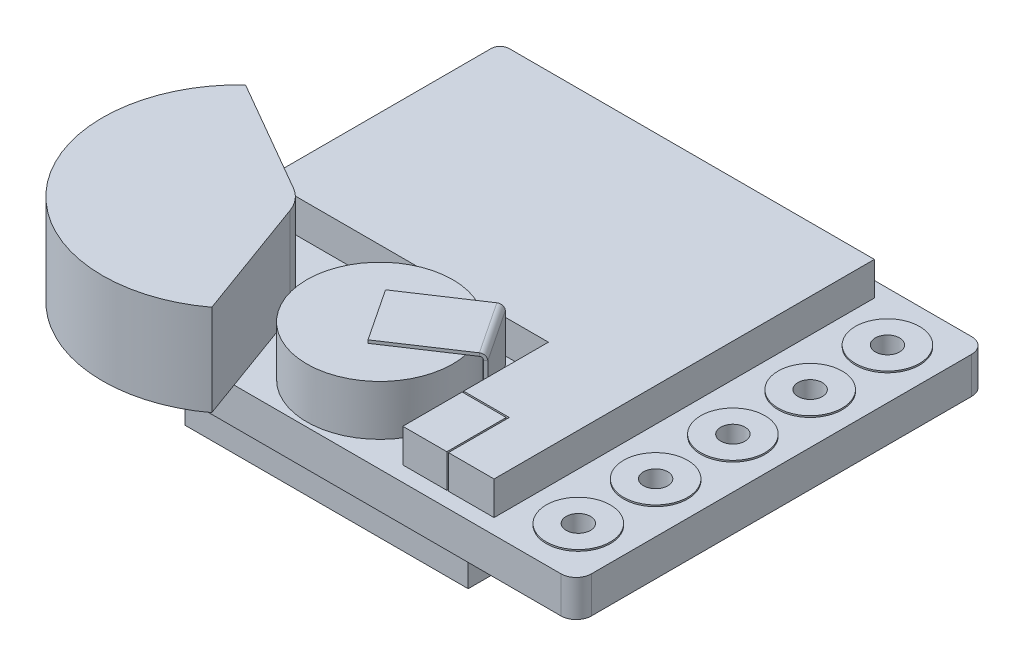
from build123d import *

# Parameters (mm, degrees)
ESQUISSE1_R                             = 0.4
PCB_DEPTH                               = 1.2
ESQUISSE2_R                             = 1.053612245
ESQUISSE2_R_2                           = 0.4
TOP_PADS_DEPTH                          = 0.05
BOTTOM_START                            = -1.25
ESQUISSE2_2_R                           = 1.053612245
ESQUISSE2_2_R_2                         = 0.4
BOTTOM_PADS_DEPTH                       = 0.05
ESQUISSE3_R                             = 2.4
BACKUP_BATT_DEPTH                       = 1.65
ANCILLARY_COMPS_DEPTH                   = 1.1
ESQUISSE5_W                             = 1.45
ESQUISSE5_H                             = 1.95
ACTIVITY_LED_DEPTH                      = 1.1
ESQUISSE6_W                             = 9.3
ESQUISSE6_H                             = 9.8
ATGM336H_MODULE_DEPTH                   = 2
MODULE_S_START                          = -0.25
ESQUISSE7_W                             = 1
ESQUISSE7_H                             = 1
MODULE_S_SOLDER_JOINTS_DEPTH            = 9.3
ESQUISSE8_R                             = 1.3
IPEX_CONNECTOR_SWIVEL_PLACEHOLDER_DEPTH = 3
BATTERY_TAB_BIS_DEPTH                   = 0.1
BATTERY_TAB_TER_STRIP_W                 = 0.6
BATTERY_TAB_TER_STRIP_H                 = 0.1
BATTERY_TAB_TER_STRIP_CUT_DEPTH         = 2.053720398
BATTERY_TAB_TER_DEPTH                   = 2.053720398


# Sheet-metal steps are written as plain solids
with BuildPart() as part:
    # Esquisse1 → PCB (new body)
    with BuildSketch(Plane(origin=(0, 0, 0), x_dir=(1, 0, 0), z_dir=(0, 1, 0))):
        with BuildLine():
            Line((-7.5, -6.75), (7.5, -6.75))
            ThreePointArc((7.5, -6.75), (7.853553391, -6.603553391), (8, -6.25))
            Line((8, -6.25), (8, 6.25))
            ThreePointArc((8, 6.25), (7.853553391, 6.603553391), (7.5, 6.75))
            Line((7.5, 6.75), (-7.5, 6.75))
            ThreePointArc((-7.5, 6.75), (-7.853553391, 6.603553391), (-8, 6.25))
            Line((-8, 6.25), (-8, -6.25))
            ThreePointArc((-8, -6.25), (-7.853553391, -6.603553391), (-7.5, -6.75))
        make_face()
        with Locations(Location((6.4, 0, 0), (0, 0, 270))):
            Circle(ESQUISSE1_R, mode=Mode.SUBTRACT)
        with Locations(Location((6.4, 2.54, 0), (0, 0, 270))):
            Circle(ESQUISSE1_R, mode=Mode.SUBTRACT)
        with Locations(Location((6.4, 5.08, 0), (0, 0, 270))):
            Circle(ESQUISSE1_R, mode=Mode.SUBTRACT)
        with Locations(Location((6.4, -5.08, 0), (0, 0, 90))):
            Circle(ESQUISSE1_R, mode=Mode.SUBTRACT)
        with Locations(Location((6.4, -2.54, 0), (0, 0, 90))):
            Circle(ESQUISSE1_R, mode=Mode.SUBTRACT)
    extrude(amount=PCB_DEPTH)

    # Esquisse2 → Top pads (add)
    # profile 1 of 5: a face of its own
    with BuildSketch(Plane(origin=(0, 1.2, 0), x_dir=(1, 0, 0), z_dir=(0, 1, 0))):
        with Locations(Location((6.4, 5.08, 0), (0, 0, 90))):
            Circle(ESQUISSE2_R)
        with Locations(Location((6.4, 5.08, 0), (0, 0, 270))):
            Circle(ESQUISSE2_R_2, mode=Mode.SUBTRACT)
    # profile 2 of 5: a face of its own
    with BuildSketch(Plane(origin=(0, 1.2, 0), x_dir=(1, 0, 0), z_dir=(0, 1, 0))):
        with Locations(Location((6.4, 2.54, 0), (0, 0, 90))):
            Circle(ESQUISSE2_R)
        with Locations(Location((6.4, 2.54, 0), (0, 0, 270))):
            Circle(ESQUISSE2_R_2, mode=Mode.SUBTRACT)
    # profile 3 of 5: a face of its own
    with BuildSketch(Plane(origin=(0, 1.2, 0), x_dir=(1, 0, 0), z_dir=(0, 1, 0))):
        with Locations(Location((6.4, 0, 0), (0, 0, 90))):
            Circle(ESQUISSE2_R)
        with Locations(Location((6.4, 0, 0), (0, 0, 270))):
            Circle(ESQUISSE2_R_2, mode=Mode.SUBTRACT)
    # profile 4 of 5: a face of its own
    with BuildSketch(Plane(origin=(0, 1.2, 0), x_dir=(1, 0, 0), z_dir=(0, 1, 0))):
        with Locations(Location((6.4, -2.54, 0), (0, 0, 90))):
            Circle(ESQUISSE2_R)
        with Locations(Location((6.4, -2.54, 0), (0, 0, 90))):
            Circle(ESQUISSE2_R_2, mode=Mode.SUBTRACT)
    # profile 5 of 5: a face of its own
    with BuildSketch(Plane(origin=(0, 1.2, 0), x_dir=(1, 0, 0), z_dir=(0, 1, 0))):
        with Locations(Location((6.4, -5.08, 0), (0, 0, 90))):
            Circle(ESQUISSE2_R)
        with Locations(Location((6.4, -5.08, 0), (0, 0, 90))):
            Circle(ESQUISSE2_R_2, mode=Mode.SUBTRACT)
    extrude(amount=TOP_PADS_DEPTH)

    # Esquisse2<2> → Bottom pads (add)
    # profile 1 of 5: a face of its own
    with BuildSketch(Plane(origin=(0, 1.2, 0), x_dir=(1, 0, 0), z_dir=(0, 1, 0)).offset(BOTTOM_START)):
        with Locations(Location((6.4, 5.08, 0), (0, 0, 90))):
            Circle(ESQUISSE2_2_R)
        with Locations(Location((6.4, 5.08, 0), (0, 0, 90))):
            Circle(ESQUISSE2_2_R_2, mode=Mode.SUBTRACT)
    # profile 2 of 5: a face of its own
    with BuildSketch(Plane(origin=(0, 1.2, 0), x_dir=(1, 0, 0), z_dir=(0, 1, 0)).offset(BOTTOM_START)):
        with Locations(Location((6.4, 2.54, 0), (0, 0, 90))):
            Circle(ESQUISSE2_2_R)
        with Locations(Location((6.4, 2.54, 0), (0, 0, 90))):
            Circle(ESQUISSE2_2_R_2, mode=Mode.SUBTRACT)
    # profile 3 of 5: a face of its own
    with BuildSketch(Plane(origin=(0, 1.2, 0), x_dir=(1, 0, 0), z_dir=(0, 1, 0)).offset(BOTTOM_START)):
        with Locations(Location((6.4, 0, 0), (0, 0, 90))):
            Circle(ESQUISSE2_2_R)
        with Locations(Location((6.4, 0, 0), (0, 0, 90))):
            Circle(ESQUISSE2_2_R_2, mode=Mode.SUBTRACT)
    # profile 4 of 5: a face of its own
    with BuildSketch(Plane(origin=(0, 1.2, 0), x_dir=(1, 0, 0), z_dir=(0, 1, 0)).offset(BOTTOM_START)):
        with Locations(Location((6.4, -2.54, 0), (0, 0, 90))):
            Circle(ESQUISSE2_2_R)
        with Locations(Location((6.4, -2.54, 0), (0, 0, 90))):
            Circle(ESQUISSE2_2_R_2, mode=Mode.SUBTRACT)
    # profile 5 of 5: a face of its own
    with BuildSketch(Plane(origin=(0, 1.2, 0), x_dir=(1, 0, 0), z_dir=(0, 1, 0)).offset(BOTTOM_START)):
        with Locations(Location((6.4, -5.08, 0), (0, 0, 90))):
            Circle(ESQUISSE2_2_R)
        with Locations(Location((6.4, -5.08, 0), (0, 0, 90))):
            Circle(ESQUISSE2_2_R_2, mode=Mode.SUBTRACT)
    extrude(amount=BOTTOM_PADS_DEPTH)

    # Esquisse3 → Backup batt (add)
    with BuildSketch(Plane(origin=(0, 1.2, 0), x_dir=(1, 0, 0), z_dir=(0, 1, 0))):
        with Locations(Location((-1, -4.204961255, 0), (0, 0, 90))):
            Circle(ESQUISSE3_R)
    extrude(amount=BACKUP_BATT_DEPTH)

    # Esquisse4 → ancillary comps (add)
    with BuildSketch(Plane(origin=(0, 1.2, 0), x_dir=(1, 0, 0), z_dir=(0, 1, 0))):
        with BuildLine():
            Line((-7.2, -1.462995273), (1.8, -1.462995273))
            Line((1.8, -1.462995273), (1.8, -4.25))
            Line((1.8, -4.25), (3.3, -4.25))
            Line((3.3, -4.25), (3.3, -6.25))
            Line((3.3, -6.25), (4.8, -6.25))
            Line((4.8, -6.25), (4.8, 6.25))
            Line((4.8, 6.25), (-7.2, 6.25))
            ThreePointArc((-7.2, 6.25), (-7.412132034, 6.162132034), (-7.5, 5.95))
            Line((-7.5, 5.95), (-7.5, -1.162995273))
            ThreePointArc((-7.5, -1.162995273), (-7.412132034, -1.375127307), (-7.2, -1.462995273))
        make_face()
    extrude(amount=ANCILLARY_COMPS_DEPTH)

    # Esquisse6 → ATGM336H module (add)
    with BuildSketch(Plane.XZ):
        with Locations((-1.45, 0.6)):
            Rectangle(ESQUISSE6_W, ESQUISSE6_H)
    extrude(amount=ATGM336H_MODULE_DEPTH)

    # Esquisse7 → module's solder joints (add)
    with BuildSketch(Plane(origin=(0, 0, -4.3), x_dir=(-1, 0, 0), z_dir=(0, 0, -1)).offset(MODULE_S_START)):
        with Locations((6.6, -0.5)):
            Rectangle(ESQUISSE7_W, ESQUISSE7_H)
        with Locations((-3.7, -0.5)):
            Rectangle(ESQUISSE7_W, ESQUISSE7_H)
    extrude(amount=-MODULE_S_SOLDER_JOINTS_DEPTH)


with BuildPart() as body_2:
    # Esquisse5 → Activity led (new body)
    with BuildSketch(Plane(origin=(0, 1.2, 0), x_dir=(1, 0, 0), z_dir=(0, 1, 0))):
        with Locations((2.525, -5.275)):
            Rectangle(ESQUISSE5_W, ESQUISSE5_H)
    extrude(amount=ACTIVITY_LED_DEPTH)


with BuildPart() as body_3:
    # Esquisse8 → IPEX connector swivel placeholder (new body)
    with BuildSketch(Plane(origin=(0, 1.2, 0), x_dir=(1, 0, 0), z_dir=(0, 1, 0))):
        with BuildLine():
            Line((-8, -6.25), (-8, -1.364459606))
            Line((-8, -1.364459606), (-8.601688499, -1.017074589))
            ThreePointArc((-8.601688499, -1.017074589), (-8.967936872, -7.18951778), (-2.8256686, -7.900667055))
            Line((-2.8256686, -7.900667055), (-3.244477157, -6.75))
            Line((-3.244477157, -6.75), (-7.5, -6.75))
            ThreePointArc((-7.5, -6.75), (-7.853553391, -6.603553391), (-8, -6.25))
        make_face()
        with Locations((-5.520736878, -4.296973537)):
            Circle(ESQUISSE8_R)
        with BuildLine():
            ThreePointArc((-4.220736878, -4.296973537), (-6.646569903, -4.946973537), (-4.870736878, -3.171140512))
            Line((-4.870736878, -3.171140512), (-8, -1.364459606))
            Line((-8, -1.364459606), (-8, -6.25))
            ThreePointArc((-8, -6.25), (-7.853553391, -6.603553391), (-7.5, -6.75))
            Line((-7.5, -6.75), (-3.244477157, -6.75))
            Line((-3.244477157, -6.75), (-4.299136471, -3.85234735))
            ThreePointArc((-4.299136471, -3.85234735), (-4.240486799, -4.071230906), (-4.220736878, -4.296973537))
        make_face()
    extrude(amount=IPEX_CONNECTOR_SWIVEL_PLACEHOLDER_DEPTH)


with BuildPart() as body_4:
    # Esquisse9 → Battery tab (bis) (new body)
    with BuildSketch(Plane(origin=(0, 2.85, 0), x_dir=(1, 0, 0), z_dir=(0, 1, 0))):
        Polygon((-0.581565149, -5.011059392), (-1.717348662, -3.299988591), (0.565655318, -1.784564286), (1.701438831, -3.495635087), align=None)
    extrude(amount=BATTERY_TAB_BIS_DEPTH)

    # Battery tab (ter) strip (across the edge) → Battery tab (ter) strip cut (cut)
    with BuildSketch(Plane(origin=(0.565655318, 2.85, 1.784564286), x_dir=(-0.8331566469901595, -3.4452318542127344e-15, 0.553037070706942), z_dir=(0.553037070706942, 0, 0.8331566469901595))):
        with Locations((-0.2, -0.05)):
            Rectangle(BATTERY_TAB_TER_STRIP_W, BATTERY_TAB_TER_STRIP_H)
    extrude(amount=BATTERY_TAB_TER_STRIP_CUT_DEPTH, mode=Mode.SUBTRACT)

    # Battery tab (ter) section (across the edge) → Battery tab (ter) (add)
    with BuildSketch(Plane(origin=(0.565655318, 2.85, 1.784564286), x_dir=(-0.8331566469901595, -3.4452318542127344e-15, 0.553037070706942), z_dir=(0.553037070706942, 0, 0.8331566469901595))):
        with BuildLine():
            Line((-0.1, 0.1), (-0.1, 1.65))
            Line((-0.1, 1.65), (0, 1.65))
            Line((0, 1.65), (0, 0.1))
            ThreePointArc((0, 0.1), (0.029289322, 0.029289322), (0.1, 0))
            Line((0.1, 0), (0.1, -0.1))
            ThreePointArc((0.1, -0.1), (-0.041421356, -0.041421356), (-0.1, 0.1))
        make_face()
    extrude(amount=BATTERY_TAB_TER_DEPTH)


solid = Compound([part.part, body_2.part, body_3.part, body_4.part])
